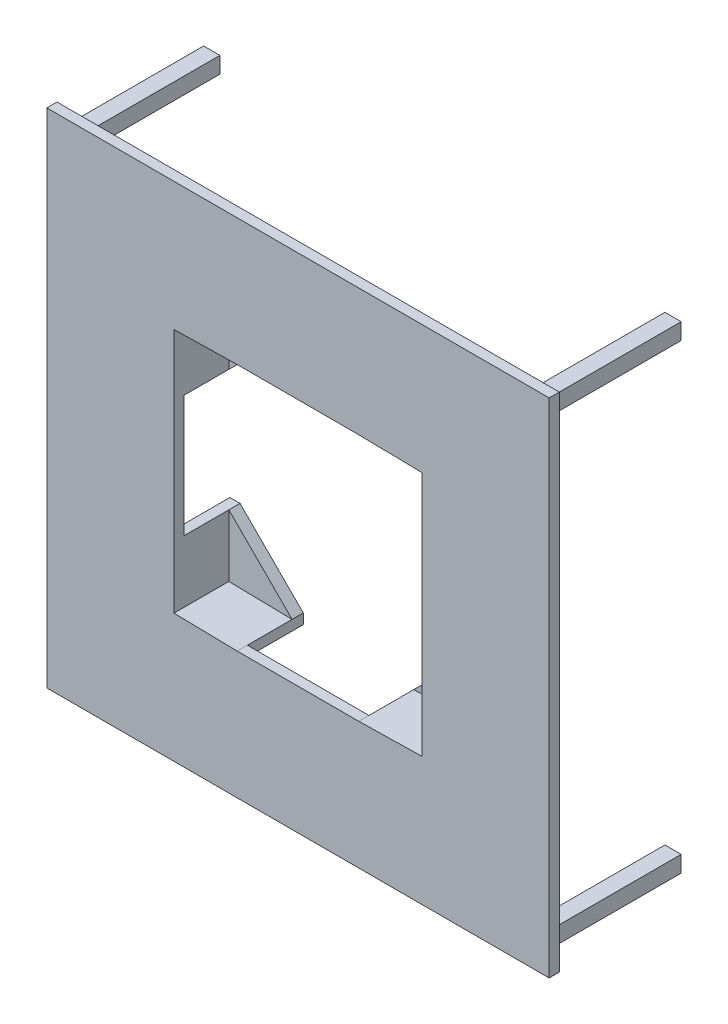
from build123d import *

# Parameters (mm, degrees)
ESBO_O1_W                     = 247
ESBO_O1_H                     = 247
RESSALTO_EXTRUS_O1_DEPTH      = 5
ESBO_O3_W                     = 122
ESBO_O3_H                     = 122
CORTE_EXTRUS_O2_DEPTH         = 175.726929808
RESSALTO_EXTRUS_O2_DEPTH      = 27.5
RESSALTO_EXTRUS_O2_DEPTH_BACK = 5
CORTE_EXTRUS_O3_DEPTH         = 27
ESBO_O8_W                     = 8
ESBO_O8_H                     = 8
RESSALTO_EXTRUS_O3_DEPTH      = 66


with BuildPart() as part:
    # Esboço1 → Ressalto-extrusão1 (new body)
    with BuildSketch(Plane.XY):
        Rectangle(ESBO_O1_W, ESBO_O1_H)
    extrude(amount=RESSALTO_EXTRUS_O1_DEPTH)

    # Esboço3 → Corte-extrusão2 (cut, through all)
    with BuildSketch(Plane.XY.offset(5)):
        Rectangle(ESBO_O3_W, ESBO_O3_H)
    extrude(amount=-CORTE_EXTRUS_O2_DEPTH, mode=Mode.SUBTRACT)

    # Esboço4 → Ressalto-extrusão2 (add, two sides: drawn at the far end of the back side and taken through both)
    with BuildSketch(Plane(origin=(0, 0, 0), x_dir=(-1, 0, 0), z_dir=(0, 0, -1)).offset(-RESSALTO_EXTRUS_O2_DEPTH_BACK)):
        Polygon((-61, 29.900213471), (-66, 29.900213471), (-66, 66), (-29.900213471, 66), (-29.900213471, 61), align=None)
        Polygon((29.900213471, 61), (61, 29.900213471), (66, 29.900213471), (66, 66), (29.900213471, 66), align=None)
        Polygon((61, -29.900213471), (66, -29.900213471), (66, -66), (29.900213471, -66), (29.900213471, -61), align=None)
        Polygon((-29.900213471, -61), (-61, -29.900213471), (-66, -29.900213471), (-66, -66), (-29.900213471, -66), align=None)
    extrude(amount=RESSALTO_EXTRUS_O2_DEPTH + RESSALTO_EXTRUS_O2_DEPTH_BACK)

    # Esboço5 → Corte-extrusão3 (cut)
    with BuildSketch(Plane.XY.offset(5)):
        Polygon((-61, 29.900213471), (-61, 60.395012091), (-29.900213471, 61), align=None)
        Polygon((61, 29.900213471), (29.900213471, 61), (61, 60.395012091), align=None)
        Polygon((61, -29.900213471), (61, -60.395012091), (29.900213471, -61), align=None)
        Polygon((-61, -29.900213471), (-29.900213471, -61), (-61, -60.395012091), align=None)
    extrude(amount=-CORTE_EXTRUS_O3_DEPTH, mode=Mode.SUBTRACT)

    # Esboço8 → Ressalto-extrusão3 (add)
    with BuildSketch(Plane(origin=(0, 0, 0), x_dir=(-1, 0, 0), z_dir=(0, 0, -1))):
        with Locations((113.4, -113.4)):
            Rectangle(ESBO_O8_W, ESBO_O8_H)
        with Locations((-113.4, -113.4)):
            Rectangle(ESBO_O8_W, ESBO_O8_H)
        with Locations((-113.4, 113.4)):
            Rectangle(ESBO_O8_W, ESBO_O8_H)
        with Locations((113.4, 113.4)):
            Rectangle(ESBO_O8_W, ESBO_O8_H)
    extrude(amount=RESSALTO_EXTRUS_O3_DEPTH)


solid = part.part
